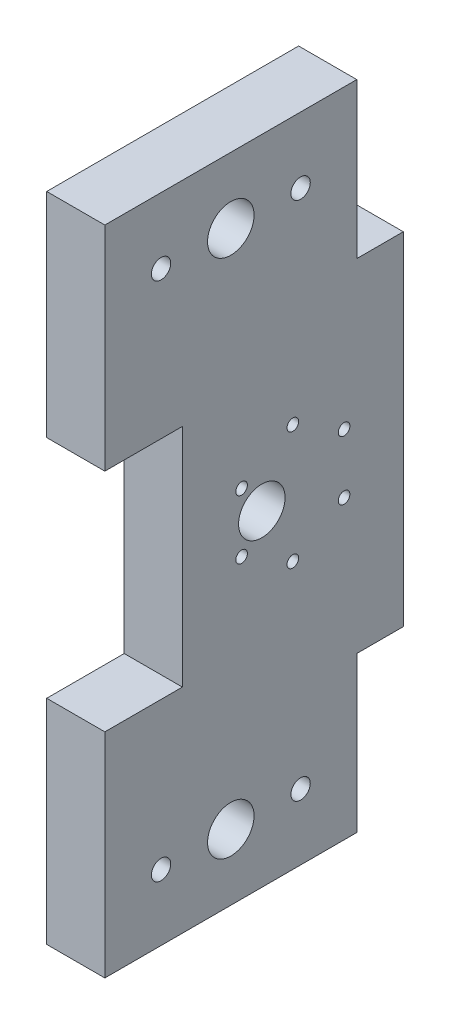
from build123d import *

# Parameters (mm, degrees)
STOCK_MOUNT_START                              = 19
STOCK_MOUNT_FOR_MOTOR_IN_THE_PLATYFO_2_W       = 50
STOCK_MOUNT_FOR_MOTOR_IN_THE_PLATYFO_2_H       = 57
STOCK_MOUNT_FOR_MOTOR_IN_THE_PLATYFO_2_R       = 1.5
STOCK_MOUNT_FOR_MOTOR_IN_THE_PLATYFO_2_R_2     = 6
STOCK_MOUNT_FOR_MOTOR_IN_THE_PLATYFORM_M_DEPTH = 15
SKETCH2_W                                      = 15
SKETCH2_H                                      = 57
BOSS_EXTRUDE1_DEPTH                            = 19.12
SKETCH3_W                                      = 15
SKETCH3_H                                      = 57
BOSS_EXTRUDE2_DEPTH                            = 19.12
SKETCH4_W                                      = 15
SKETCH4_H                                      = 15
BOSS_EXTRUDE3_DEPTH                            = 20
SKETCH10_W                                     = 15
SKETCH10_H                                     = 65
BOSS_EXTRUDE6_DEPTH                            = 40
SKETCH11_R                                     = 6
SKETCH11_R_2                                   = 2.5
CUT_EXTRUDE2_DEPTH                             = 132.238616268


# Read off the part's stored shape, not the designer's step: Stock-mount for motor in the platyform mechanism-1
with BuildPart() as part:
    # Stock-mount for motor in the platyfo 2 → Stock-mount for motor in the platyform mechanism-1 (new body)
    with BuildSketch(Plane.YZ.offset(STOCK_MOUNT_START)):
        with Locations((-35, 4.5)):
            Rectangle(STOCK_MOUNT_FOR_MOTOR_IN_THE_PLATYFO_2_W, STOCK_MOUNT_FOR_MOTOR_IN_THE_PLATYFO_2_H)
        with Locations((-42.6325, -8.719877789)):
            Circle(STOCK_MOUNT_FOR_MOTOR_IN_THE_PLATYFO_2_R, mode=Mode.SUBTRACT)
        with Locations((-27.3675, -8.719877789)):
            Circle(STOCK_MOUNT_FOR_MOTOR_IN_THE_PLATYFO_2_R, mode=Mode.SUBTRACT)
        with Locations((-50.265, 4.5)):
            Circle(STOCK_MOUNT_FOR_MOTOR_IN_THE_PLATYFO_2_R, mode=Mode.SUBTRACT)
        with Locations((-42.6325, 17.719877789)):
            Circle(STOCK_MOUNT_FOR_MOTOR_IN_THE_PLATYFO_2_R, mode=Mode.SUBTRACT)
        with Locations((-35, 12.5)):
            Circle(STOCK_MOUNT_FOR_MOTOR_IN_THE_PLATYFO_2_R_2, mode=Mode.SUBTRACT)
        with Locations((-27.3675, 17.719877789)):
            Circle(STOCK_MOUNT_FOR_MOTOR_IN_THE_PLATYFO_2_R, mode=Mode.SUBTRACT)
        with Locations((-19.735, 4.5)):
            Circle(STOCK_MOUNT_FOR_MOTOR_IN_THE_PLATYFO_2_R, mode=Mode.SUBTRACT)
    extrude(amount=STOCK_MOUNT_FOR_MOTOR_IN_THE_PLATYFORM_M_DEPTH)

    # Sketch2 → Boss-Extrude1 (add)
    with BuildSketch(Plane.XZ.offset(60)):
        with Locations((26.5, 4.5)):
            Rectangle(SKETCH2_W, SKETCH2_H)
    extrude(amount=BOSS_EXTRUDE1_DEPTH)

    # Sketch3 → Boss-Extrude2 (add)
    with BuildSketch(Plane(origin=(0, -10, 0), x_dir=(1, 0, 0), z_dir=(0, 1, 0))):
        with Locations((26.5, -4.5)):
            Rectangle(SKETCH3_W, SKETCH3_H)
    extrude(amount=BOSS_EXTRUDE2_DEPTH)

    # Sketch4 → Boss-Extrude3 (add)
    with BuildSketch(Plane.XY.offset(33)):
        with Locations((26.5, 1.62)):
            Rectangle(SKETCH4_W, SKETCH4_H)
        with Locations((26.5, -71.62)):
            Rectangle(SKETCH4_W, SKETCH4_H)
    extrude(amount=BOSS_EXTRUDE3_DEPTH)

    # Sketch10 → Boss-Extrude6 (add)
    with BuildSketch(Plane(origin=(0, -79.12, 0), x_dir=(-1, 0, 0), z_dir=(0, -1, 0))):
        with Locations((-26.5, -20.5)):
            Rectangle(SKETCH10_W, SKETCH10_H)
    boss_extrude6 = extrude(amount=BOSS_EXTRUDE6_DEPTH)

    # Mirror1: Boss-Extrude6 across plane
    add(boss_extrude6.mirror(Plane.ZX.offset(-35)))

    # Sketch11 → Cut-Extrude2 (cut, through all)
    with BuildSketch(Plane.ZY.offset(-19)):
        with Locations(Location((20.5, -102.12, 0), (0, 0, 270))):
            Circle(SKETCH11_R)
        with Locations(Location((2.5, -102.12, 0), (0, 0, 270))):
            Circle(SKETCH11_R_2)
        with Locations(Location((38.5, -102.12, 0), (0, 0, 90))):
            Circle(SKETCH11_R_2)
        with Locations(Location((38.5, 32.12, 0), (0, 0, 270))):
            Circle(SKETCH11_R_2)
        with Locations(Location((20.5, 32.12, 0), (0, 0, 90))):
            Circle(SKETCH11_R)
        with Locations(Location((2.5, 32.12, 0), (0, 0, 90))):
            Circle(SKETCH11_R_2)
    extrude(amount=-CUT_EXTRUDE2_DEPTH, mode=Mode.SUBTRACT)


solid = part.part
